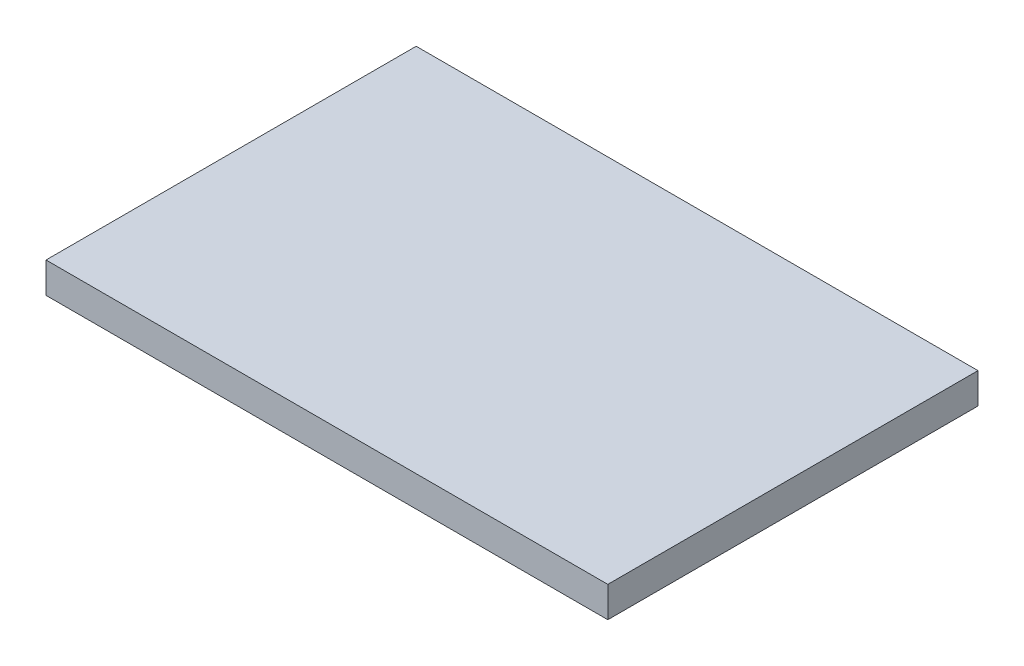
from build123d import *

# Parameters (mm, degrees)
SKETCH1_W           = 733
SKETCH1_H           = 483
BOSS_EXTRUDE1_DEPTH = 40


with BuildPart() as part:
    # Sketch1 → Boss-Extrude1 (new body)
    with BuildSketch(Plane(origin=(0, 0, 0), x_dir=(1, 0, 0), z_dir=(0, 1, 0))):
        Rectangle(SKETCH1_W, SKETCH1_H)
    extrude(amount=BOSS_EXTRUDE1_DEPTH)


solid = part.part
